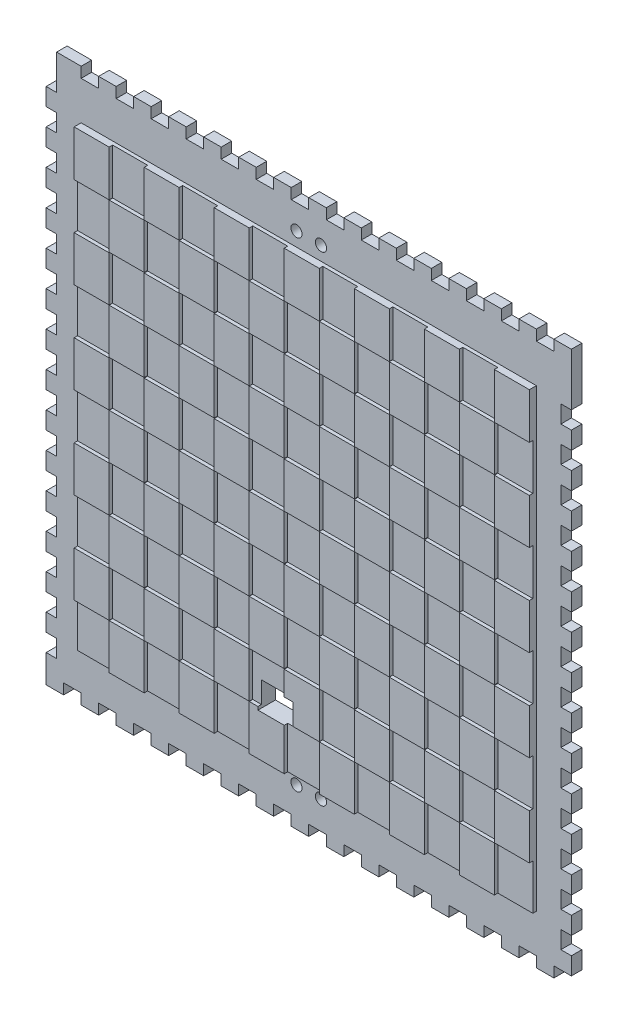
from build123d import *

# Parameters (mm, degrees)
SKETCH1_W                = 150
SKETCH1_H                = 158
BOSS_EXTRUDE1_DEPTH      = 5
SKETCH2_W                = 150
SKETCH2_H                = 158
SKETCH2_W_2              = 130
SKETCH2_H_2              = 130
CUT_EXTRUDE1_DEPTH       = 2
SKETCH3_W                = 10
SKETCH3_H                = 13.1
CUT_EXTRUDE2_DEPTH       = 1
LPATTERN1_COUNT          = 7
LPATTERN1_PITCH          = 20
LPATTERN1_COUNT_DIR2     = 5
LPATTERN1_PITCH_DIR2     = 26
SKETCH4_W                = 10
SKETCH4_H                = 13.1
CUT_EXTRUDE3_DEPTH       = 1
LPATTERN2_COUNT          = 6
LPATTERN2_PITCH          = 20
LPATTERN2_COUNT_DIR2     = 5
LPATTERN2_PITCH_DIR2     = 26
SKETCH5_W                = 5
SKETCH5_H                = 3
CUT_EXTRUDE4_DEPTH       = 109.972473589
SKETCH6_W                = 3
SKETCH6_H                = 10
CUT_EXTRUDE5_DEPTH       = 109.972473589
SKETCH7_W                = 3
SKETCH7_H                = 5
CUT_EXTRUDE6_DEPTH       = 109.972473589
LPATTERN3_COUNT          = 14
LPATTERN3_PITCH          = 10
SKETCH8_W                = 5
SKETCH8_H                = 3
CUT_EXTRUDE7_DEPTH       = 109.972473589
LPATTERN4_COUNT          = 15
LPATTERN4_PITCH          = 10
SKETCH9_W                = 3
SKETCH9_H                = 5
CUT_EXTRUDE8_DEPTH       = 10
LPATTERN5_COUNT          = 14
LPATTERN5_PITCH          = 10
SKETCH10_R               = 1.6
CUT_EXTRUDE9_DEPTH       = 15
SKETCH12_R               = 1.6
CUT_EXTRUDE10_DEPTH      = 10
BOSS_EXTRUDE2_DEPTH      = 12
BOSS_EXTRUDE2_DEPTH_BACK = 68
SKETCH13_W               = 4
SKETCH13_H               = 2
SKETCH14_R               = 1
SKETCH14_R_2             = 1.10521544
CUT_EXTRUDE11_DEPTH      = 4
SKETCH15_W               = 10
SKETCH15_H               = 7
CUT_EXTRUDE12_DEPTH      = 110.045861911
SKETCH16_W               = 4
SKETCH16_H               = 2
BOSS_EXTRUDE3_DEPTH      = 68
SKETCH17_R               = 1
CUT_EXTRUDE13_DEPTH      = 130.94614269


with BuildPart() as part:
    # Sketch1 → Boss-Extrude1 (new body)
    with BuildSketch(Plane.XY):
        Rectangle(SKETCH1_W, SKETCH1_H)
    extrude(amount=BOSS_EXTRUDE1_DEPTH)

    # Sketch2 → Cut-Extrude1 (cut)
    with BuildSketch(Plane.XY.offset(5)):
        Rectangle(SKETCH2_W, SKETCH2_H)
        Rectangle(SKETCH2_W_2, SKETCH2_H_2, mode=Mode.SUBTRACT)
    extrude(amount=-CUT_EXTRUDE1_DEPTH, mode=Mode.SUBTRACT)

    # Sketch3 → Cut-Extrude2 (cut)
    with BuildSketch(Plane.XY.offset(5)):
        with Locations((-60, 45.4)):
            Rectangle(SKETCH3_W, SKETCH3_H)
    cut_extrude2 = extrude(amount=-CUT_EXTRUDE2_DEPTH, mode=Mode.SUBTRACT)

    # LPattern1: Cut-Extrude2 7 × 5
    with Locations(*[(i * LPATTERN1_PITCH, -j * LPATTERN1_PITCH_DIR2, 0) for i in range(LPATTERN1_COUNT) for j in range(LPATTERN1_COUNT_DIR2) if (i, j) != (0, 0)]):
        add(cut_extrude2, mode=Mode.SUBTRACT)

    # Sketch4 → Cut-Extrude3 (cut)
    with BuildSketch(Plane.XY.offset(5)):
        with Locations((-50, 58.45)):
            Rectangle(SKETCH4_W, SKETCH4_H)
    cut_extrude3 = extrude(amount=-CUT_EXTRUDE3_DEPTH, mode=Mode.SUBTRACT)

    # LPattern2: Cut-Extrude3 6 × 5
    with Locations(*[(i * LPATTERN2_PITCH, -j * LPATTERN2_PITCH_DIR2, 0) for i in range(LPATTERN2_COUNT) for j in range(LPATTERN2_COUNT_DIR2) if (i, j) != (0, 0)]):
        add(cut_extrude3, mode=Mode.SUBTRACT)

    # Sketch5 → Cut-Extrude4 (cut, through all)
    with BuildSketch(Plane.XY.offset(3)):
        with Locations((-62.5, 77.5)):
            Rectangle(SKETCH5_W, SKETCH5_H)
        with Locations((-52.5, 77.5)):
            Rectangle(SKETCH5_W, SKETCH5_H)
        with Locations((-42.5, 77.5)):
            Rectangle(SKETCH5_W, SKETCH5_H)
        with Locations((-32.5, 77.5)):
            Rectangle(SKETCH5_W, SKETCH5_H)
        with Locations((-22.5, 77.5)):
            Rectangle(SKETCH5_W, SKETCH5_H)
        with Locations((-12.5, 77.5)):
            Rectangle(SKETCH5_W, SKETCH5_H)
        with Locations((-2.5, 77.5)):
            Rectangle(SKETCH5_W, SKETCH5_H)
        with Locations((7.5, 77.5)):
            Rectangle(SKETCH5_W, SKETCH5_H)
        with Locations((17.5, 77.5)):
            Rectangle(SKETCH5_W, SKETCH5_H)
        with Locations((27.5, 77.5)):
            Rectangle(SKETCH5_W, SKETCH5_H)
        with Locations((37.5, 77.5)):
            Rectangle(SKETCH5_W, SKETCH5_H)
        with Locations((47.5, 77.5)):
            Rectangle(SKETCH5_W, SKETCH5_H)
        with Locations((57.5, 77.5)):
            Rectangle(SKETCH5_W, SKETCH5_H)
        with Locations((67.5, 77.5)):
            Rectangle(SKETCH5_W, SKETCH5_H)
    extrude(amount=-CUT_EXTRUDE4_DEPTH, mode=Mode.SUBTRACT)

    # Sketch6 → Cut-Extrude5 (cut, through all)
    with BuildSketch(Plane.XY.offset(3)):
        with Locations((-73.5, 74)):
            Rectangle(SKETCH6_W, SKETCH6_H)
    extrude(amount=-CUT_EXTRUDE5_DEPTH, mode=Mode.SUBTRACT)

    # Sketch7 → Cut-Extrude6 (cut, through all)
    with BuildSketch(Plane.XY.offset(3)):
        with Locations((-73.5, 61.5)):
            Rectangle(SKETCH7_W, SKETCH7_H)
    cut_extrude6 = extrude(amount=-CUT_EXTRUDE6_DEPTH, mode=Mode.SUBTRACT)

    # LPattern3: Cut-Extrude6 ×14
    with Locations(*[(0, -i * LPATTERN3_PITCH, 0) for i in range(1, LPATTERN3_COUNT)]):
        add(cut_extrude6, mode=Mode.SUBTRACT)

    # Sketch8 → Cut-Extrude7 (cut, through all)
    with BuildSketch(Plane.XY.offset(3)):
        with Locations((-67.5, -77.5)):
            Rectangle(SKETCH8_W, SKETCH8_H)
    cut_extrude7 = extrude(amount=-CUT_EXTRUDE7_DEPTH, mode=Mode.SUBTRACT)

    # LPattern4: Cut-Extrude7 ×15
    with Locations(*[(i * LPATTERN4_PITCH, 0, 0) for i in range(1, LPATTERN4_COUNT)]):
        add(cut_extrude7, mode=Mode.SUBTRACT)

    # Sketch9 → Cut-Extrude8 (cut)
    with BuildSketch(Plane.XY.offset(3)):
        with Locations((73.5, -68.5)):
            Rectangle(SKETCH9_W, SKETCH9_H)
    cut_extrude8 = extrude(amount=-CUT_EXTRUDE8_DEPTH, mode=Mode.SUBTRACT)

    # LPattern5: Cut-Extrude8 ×14
    with Locations(*[(0, i * LPATTERN5_PITCH, 0) for i in range(1, LPATTERN5_COUNT)]):
        add(cut_extrude8, mode=Mode.SUBTRACT)

    # Sketch10 → Cut-Extrude9 (cut)
    with BuildSketch(Plane.XY.offset(3)):
        with Locations((-3.5, 69)):
            Circle(SKETCH10_R)
        with Locations((3.5, 69)):
            Circle(SKETCH10_R)
    extrude(amount=-CUT_EXTRUDE9_DEPTH, mode=Mode.SUBTRACT)

    # Sketch12 → Cut-Extrude10 (cut)
    with BuildSketch(Plane.XY.offset(3)):
        with Locations((3.5, -68)):
            Circle(SKETCH12_R)
        with Locations((-3.5, -68)):
            Circle(SKETCH12_R)
    extrude(amount=-CUT_EXTRUDE10_DEPTH, mode=Mode.SUBTRACT)

    # Sketch13 → Boss-Extrude2 (add, two sides: drawn at the far end of the back side and taken through both)
    with BuildSketch(Plane(origin=(0, 0, 0), x_dir=(0, 0, -1), z_dir=(1, 0, 0)).offset(-BOSS_EXTRUDE2_DEPTH_BACK)):
        with Locations((2, -45)):
            Rectangle(SKETCH13_W, SKETCH13_H)
    extrude(amount=BOSS_EXTRUDE2_DEPTH + BOSS_EXTRUDE2_DEPTH_BACK)

    # Sketch14 → Cut-Extrude11 (cut)
    with BuildSketch(Plane(origin=(0, -44, 0), x_dir=(1, 0, 0), z_dir=(0, 1, 0))):
        with Locations(Location((-33.9, 2.1, 0), (0, 0, 270))):
            Circle(SKETCH14_R)
        with Locations(Location((-30.1, 2.1, 0), (0, 0, 270))):
            Circle(SKETCH14_R)
        with Locations(Location((6.1, 2.1, 0), (0, 0, 270))):
            Circle(SKETCH14_R_2)
    extrude(amount=-CUT_EXTRUDE11_DEPTH, mode=Mode.SUBTRACT)

    # Sketch15 → Cut-Extrude12 (cut, through all)
    with BuildSketch(Plane(origin=(0, 0, 0), x_dir=(-1, 0, 0), z_dir=(0, 0, -1))):
        with Locations((7.5, -49.5)):
            Rectangle(SKETCH15_W, SKETCH15_H)
    extrude(amount=-CUT_EXTRUDE12_DEPTH, mode=Mode.SUBTRACT)

    # Sketch16 → Boss-Extrude3 (add)
    with BuildSketch(Plane(origin=(0, 0, 0), x_dir=(0, 0, -1), z_dir=(1, 0, 0))):
        with Locations((2, -28)):
            Rectangle(SKETCH16_W, SKETCH16_H)
    extrude(amount=-BOSS_EXTRUDE3_DEPTH)

    # Sketch17 → Cut-Extrude13 (cut, through all)
    with BuildSketch(Plane(origin=(0, -27, 0), x_dir=(1, 0, 0), z_dir=(0, 1, 0))):
        with Locations(Location((-33.9, 2.1, 0), (0, 0, 270))):
            Circle(SKETCH17_R)
    extrude(amount=-CUT_EXTRUDE13_DEPTH, mode=Mode.SUBTRACT)


solid = part.part
